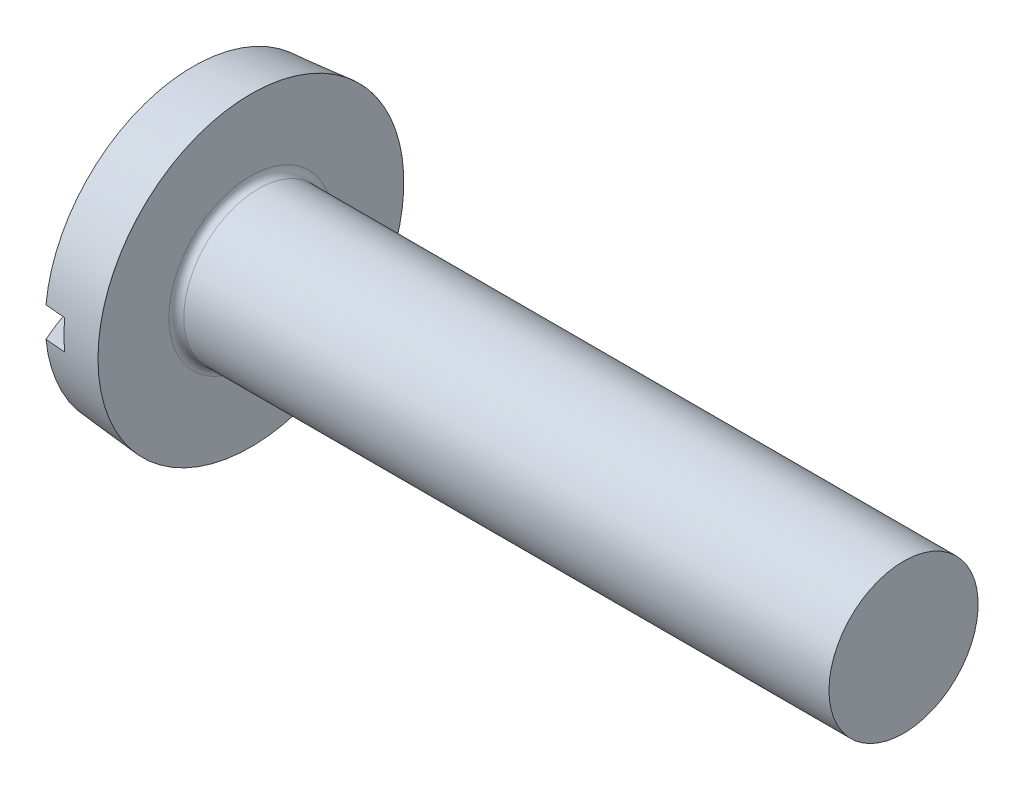
from build123d import *

# Parameters (mm, degrees)
FILLET1_R  = 0.4
SKETCH2_W  = 16.4
SKETCH2_H  = 1.6
SLOT_DEPTH = 2.8


with BuildPart() as part:
    # BodySke → Base-Revolve (revolve)
    with BuildSketch(Plane.XY):
        with BuildLine():
            Line((4.8, 4), (4.8, 8.2))
            Line((4.8, 8.2), (4.79, 8.2))
            Line((4.79, 8.2), (1.7, 7.92966003))
            ThreePointArc((1.7, 7.92966003), (0.429774249, 4.054920104), (0, 0))
            Line((0, 0), (39.8, 0))
            Line((39.8, 0), (39.8, 4))
            Line((39.8, 4), (4.8, 4))
        make_face()
    revolve(axis=Axis((-25.4, 0, 0), (1, 0, 0)))

    # Fillet1
    fillet1_edges = [part.edges().sort_by_distance(p)[0] for p in [
        (4.8, -4, 0),
    ]]
    fillet(fillet1_edges, radius=FILLET1_R)

    # Sketch2 → Slot (cut)
    with BuildSketch(Plane(origin=(0, 0, 0), x_dir=(0, 0, -1), z_dir=(1, 0, 0))):
        Rectangle(SKETCH2_W, SKETCH2_H)
    extrude(amount=SLOT_DEPTH, mode=Mode.SUBTRACT)


solid = part.part
